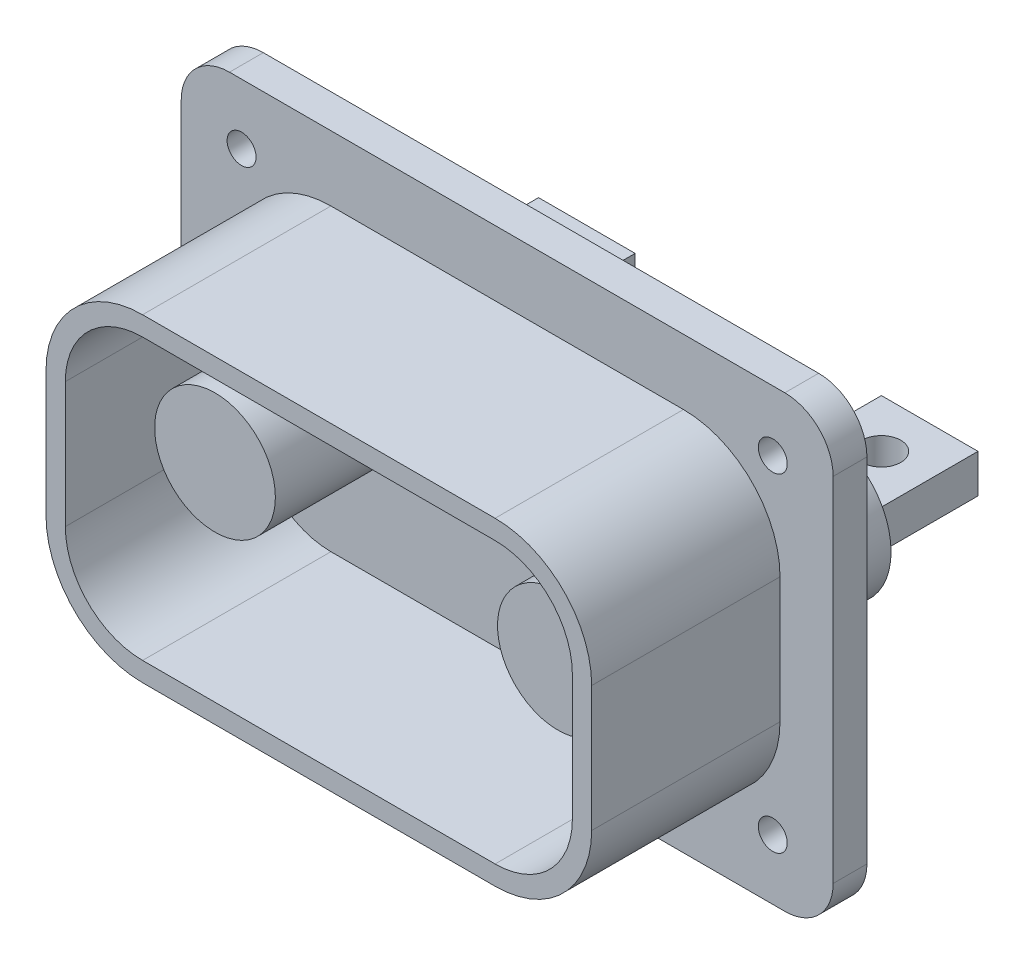
from build123d import *

# Parameters (mm, degrees)
SKETCH1_W           = 135
SKETCH1_H           = 93
SKETCH1_R           = 3
BOSS_EXTRUDE1_DEPTH = 7
BOSS_EXTRUDE2_DEPTH = 39
FILLET1_R           = 10
SKETCH3_R           = 15
BOSS_EXTRUDE3_DEPTH = 22
SKETCH5_W           = 20
SKETCH5_H           = 8
BOSS_EXTRUDE4_DEPTH = 23
SKETCH6_R           = 4
CUT_EXTRUDE1_DEPTH  = 97.033848199
SKETCH7_R           = 12.5
BOSS_EXTRUDE5_DEPTH = 25


with BuildPart() as part:
    # Sketch1 → Boss-Extrude1 (new body)
    with BuildSketch(Plane.XY):
        Rectangle(SKETCH1_W, SKETCH1_H)
        with Locations((-55, -34)):
            Circle(SKETCH1_R, mode=Mode.SUBTRACT)
        with Locations((55, -34)):
            Circle(SKETCH1_R, mode=Mode.SUBTRACT)
        with Locations((-55, 34)):
            Circle(SKETCH1_R, mode=Mode.SUBTRACT)
        with Locations((55, 34)):
            Circle(SKETCH1_R, mode=Mode.SUBTRACT)
    extrude(amount=BOSS_EXTRUDE1_DEPTH)

    # Sketch2 → Boss-Extrude2 (add)
    with BuildSketch(Plane.XY.offset(7)):
        with BuildLine():
            Line((-36.5, 33), (36.5, 33))
            ThreePointArc((36.5, 33), (50.642135624, 27.142135624), (56.5, 13))
            Line((56.5, 13), (56.5, -13))
            ThreePointArc((56.5, -13), (50.642135624, -27.142135624), (36.5, -33))
            Line((36.5, -33), (-36.5, -33))
            ThreePointArc((-36.5, -33), (-50.642135624, -27.142135624), (-56.5, -13))
            Line((-56.5, -13), (-56.5, 13))
            ThreePointArc((-56.5, 13), (-50.642135624, 27.142135624), (-36.5, 33))
        make_face()
        with BuildLine():
            Line((-52.5, 13), (-52.5, -13))
            ThreePointArc((-52.5, -13), (-47.813708499, -24.313708499), (-36.5, -29))
            Line((-36.5, -29), (36.5, -29))
            ThreePointArc((36.5, -29), (47.813708499, -24.313708499), (52.5, -13))
            Line((52.5, -13), (52.5, 13))
            ThreePointArc((52.5, 13), (47.813708499, 24.313708499), (36.5, 29))
            Line((36.5, 29), (-36.5, 29))
            ThreePointArc((-36.5, 29), (-47.813708499, 24.313708499), (-52.5, 13))
        make_face(mode=Mode.SUBTRACT)
    extrude(amount=BOSS_EXTRUDE2_DEPTH)

    # Fillet1
    fillet1_edges = [part.edges().sort_by_distance(p)[0] for p in [
        (67.5, 46.5, 3.5),
        (67.5, -46.5, 3.5),
        (-67.5, -46.5, 3.5),
        (-67.5, 46.5, 3.5),
    ]]
    fillet(fillet1_edges, radius=FILLET1_R)

    # Sketch3 → Boss-Extrude3 (add)
    with BuildSketch(Plane(origin=(0, 0, 0), x_dir=(-1, 0, 0), z_dir=(0, 0, -1))):
        with Locations((-35.5, 0)):
            Circle(SKETCH3_R)
        with Locations((35.5, 0)):
            Circle(SKETCH3_R)
    extrude(amount=BOSS_EXTRUDE3_DEPTH)

    # Sketch5 → Boss-Extrude4 (add)
    with BuildSketch(Plane(origin=(0, 0, -22), x_dir=(-1, 0, 0), z_dir=(0, 0, -1))):
        with Locations((-35.5, 0)):
            Rectangle(SKETCH5_W, SKETCH5_H)
        with Locations((35.5, 0)):
            Rectangle(SKETCH5_W, SKETCH5_H)
    extrude(amount=BOSS_EXTRUDE4_DEPTH)

    # Sketch6 → Cut-Extrude1 (cut, through all)
    with BuildSketch(Plane(origin=(0, 4, 0), x_dir=(1, 0, 0), z_dir=(0, 1, 0))):
        with Locations((35.5, 35)):
            Circle(SKETCH6_R)
        with Locations((-35.5, 35)):
            Circle(SKETCH6_R)
    extrude(amount=-CUT_EXTRUDE1_DEPTH, mode=Mode.SUBTRACT)

    # Sketch7 → Boss-Extrude5 (add)
    with BuildSketch(Plane.XY.offset(7)):
        with Locations((-35.5, 0)):
            Circle(SKETCH7_R)
        with Locations((35.5, 0)):
            Circle(SKETCH7_R)
    extrude(amount=BOSS_EXTRUDE5_DEPTH)


solid = part.part
